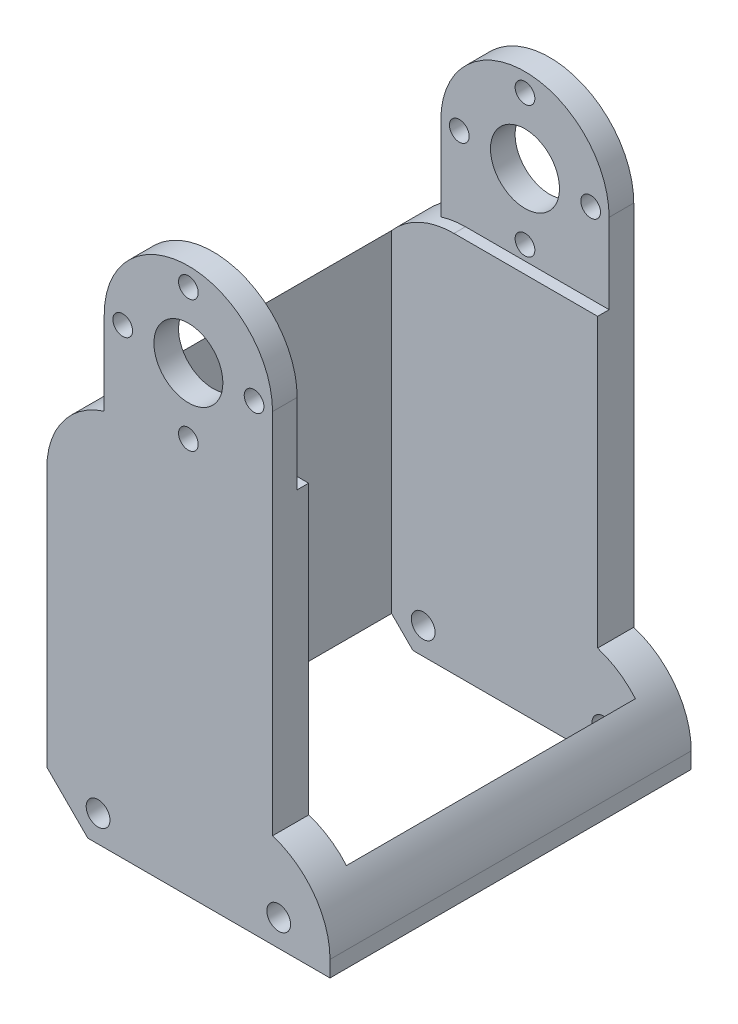
from build123d import *

# Parameters (mm, degrees)
BOSS_EXTRUDE1_DEPTH      = 22
BOSS_EXTRUDE1_DEPTH_BACK = 22
SKETCH2_W                = 38
SKETCH2_H                = 20
CUT_EXTRUDE1_DEPTH       = 105.423416914
SKETCH3_W                = 7
SKETCH3_H                = 44
BOSS_EXTRUDE2_DEPTH      = 65.5
SKETCH23_R               = 5
SKETCH23_R_2             = 1.2
CUT_EXTRUDE2_DEPTH       = 111.605436123
SKETCH24_W               = 28.5
SKETCH24_H               = 34
CUT_EXTRUDE3_DEPTH       = 90.954502389
SKETCH26_R               = 1.2
SKETCH26_R_2             = 5
SKETCH26_R_3             = 1.45
CUT_EXTRUDE6_DEPTH       = 107.330263801
SKETCH27_W               = 29.7
SKETCH27_H               = 35.2
CUT_EXTRUDE8_DEPTH       = 73.137455597
SKETCH29_W               = 7
SKETCH29_H               = 35
CUT_EXTRUDE10_DEPTH      = 74.468530678
CHAMFER2_SIZE            = 5
FILLET1_START            = -23
FILLET1_DEPTH            = 46
FILLET2_R                = 10


with BuildPart() as part:
    # Sketch1 → Boss-Extrude1 (new, two sides: drawn at the far end of the back side and taken through both)
    with BuildSketch(Plane.XY.offset(-BOSS_EXTRUDE1_DEPTH_BACK)):
        with BuildLine():
            Line((10.25, -60), (10.25, 0))
            ThreePointArc((10.25, 0), (0, -10.25), (-10.25, 0))
            Line((-10.25, 0), (-10.25, -60))
            Line((-10.25, -60), (-10.25, -100))
            Line((-10.25, -100), (10.25, -100))
            Line((10.25, -100), (10.25, -60))
        make_face()
        with BuildLine():
            Line((10.25, 0), (9.2, 0))
            ThreePointArc((9.2, 0), (8.816088231, -0.879772698), (7.91, -1.196620241))
            ThreePointArc((7.91, -1.196620241), (5.656854249, -5.656854249), (1.196620241, -7.91))
            ThreePointArc((1.196620241, -7.91), (1.199154762, -7.954968281), (1.2, -8))
            ThreePointArc((1.2, -8), (-0.045031719, -9.199154762), (-1.196620241, -7.91))
            ThreePointArc((-1.196620241, -7.91), (-5.656854249, -5.656854249), (-7.91, -1.196620241))
            ThreePointArc((-7.91, -1.196620241), (-8.816088231, -0.879772698), (-9.2, 0))
            Line((-9.2, 0), (-10.25, 0))
            ThreePointArc((-10.25, 0), (0, -10.25), (10.25, 0))
        make_face()
        with BuildLine():
            ThreePointArc((7.91, -1.196620241), (7.120227302, -0.816088231), (6.8, 0))
            Line((6.8, 0), (4.2, 0))
            ThreePointArc((4.2, 0), (0, -4.2), (-4.2, 0))
            Line((-4.2, 0), (-6.8, 0))
            ThreePointArc((-6.8, 0), (-7.120227302, -0.816088231), (-7.91, -1.196620241))
            ThreePointArc((-7.91, -1.196620241), (-5.656854249, -5.656854249), (-1.196620241, -7.91))
            ThreePointArc((-1.196620241, -7.91), (0, -6.8), (1.196620241, -7.91))
            ThreePointArc((1.196620241, -7.91), (5.656854249, -5.656854249), (7.91, -1.196620241))
        make_face()
        with BuildLine():
            Line((4.2, 0), (6.8, 0))
            ThreePointArc((6.8, 0), (7.120227302, 0.816088231), (7.91, 1.196620241))
            ThreePointArc((7.91, 1.196620241), (5.656854249, 5.656854249), (1.196620241, 7.91))
            ThreePointArc((1.196620241, 7.91), (0, 6.8), (-1.196620241, 7.91))
            ThreePointArc((-1.196620241, 7.91), (-5.656854249, 5.656854249), (-7.91, 1.196620241))
            ThreePointArc((-7.91, 1.196620241), (-7.120227302, 0.816088231), (-6.8, 0))
            Line((-6.8, 0), (-4.2, 0))
            ThreePointArc((-4.2, 0), (0, 4.2), (4.2, 0))
        make_face()
        with BuildLine():
            ThreePointArc((7.91, 1.196620241), (8.816088231, 0.879772698), (9.2, 0))
            Line((9.2, 0), (10.25, 0))
            ThreePointArc((10.25, 0), (0, 10.25), (-10.25, 0))
            Line((-10.25, 0), (-9.2, 0))
            ThreePointArc((-9.2, 0), (-8.816088231, 0.879772698), (-7.91, 1.196620241))
            ThreePointArc((-7.91, 1.196620241), (-5.656854249, 5.656854249), (-1.196620241, 7.91))
            ThreePointArc((-1.196620241, 7.91), (-0.045031719, 9.199154762), (1.2, 8))
            ThreePointArc((1.2, 8), (1.199154762, 7.954968281), (1.196620241, 7.91))
            ThreePointArc((1.196620241, 7.91), (5.656854249, 5.656854249), (7.91, 1.196620241))
        make_face()
    extrude(amount=BOSS_EXTRUDE1_DEPTH + BOSS_EXTRUDE1_DEPTH_BACK)

    # Sketch2 → Cut-Extrude1 (cut, through all)
    with BuildSketch(Plane.ZY.offset(10.25)):
        with Locations((0, 0.25)):
            Rectangle(SKETCH2_W, SKETCH2_H)
    extrude(amount=-CUT_EXTRUDE1_DEPTH, mode=Mode.SUBTRACT)

    # Sketch3 → Boss-Extrude2 (add)
    with BuildSketch(Plane(origin=(0, -9.75, 0), x_dir=(1, 0, 0), z_dir=(0, 1, 0))):
        with Locations((-13.75, 0)):
            Rectangle(SKETCH3_W, SKETCH3_H)
        with Locations((13.75, 0)):
            Rectangle(SKETCH3_W, SKETCH3_H)
    extrude(amount=-BOSS_EXTRUDE2_DEPTH)

    # Sketch23 → Cut-Extrude2 (cut, through all)
    with BuildSketch(Plane.XY.offset(22)):
        with BuildLine():
            Line((-10.25, -100), (10.25, -100))
            Line((10.25, -100), (10.25, -85))
            ThreePointArc((10.25, -85), (0, -95.25), (-10.25, -85))
            Line((-10.25, -85), (-10.25, -100))
        make_face()
        with Locations((0, -85)):
            Circle(SKETCH23_R)
        with Locations((8, -85)):
            Circle(SKETCH23_R_2)
        with Locations((0, -77)):
            Circle(SKETCH23_R_2)
        with Locations((0, -93)):
            Circle(SKETCH23_R_2)
        with Locations((-8, -85)):
            Circle(SKETCH23_R_2)
    extrude(amount=-CUT_EXTRUDE2_DEPTH, mode=Mode.SUBTRACT)

    # Sketch24 → Cut-Extrude3 (cut, through all)
    with BuildSketch(Plane(origin=(0, -9.75, 0), x_dir=(1, 0, 0), z_dir=(0, 1, 0))):
        Rectangle(SKETCH24_W, SKETCH24_H)
    extrude(amount=-CUT_EXTRUDE3_DEPTH, mode=Mode.SUBTRACT)

    # Sketch26 → Cut-Extrude6 (cut, through all)
    # profile 1 of 5: a face of its own
    with BuildSketch(Plane.XY.offset(22)):
        with BuildLine():
            Line((10.25, -75.25), (14.25, -75.25))
            Line((14.25, -75.25), (14.25, -56.53282359))
            Line((14.25, -56.53282359), (14.25, -56.25))
            Line((14.25, -56.25), (-14.25, -56.25))
            Line((-14.25, -56.25), (-14.25, -56.53282359))
            Line((-14.25, -56.53282359), (-14.25, -75.25))
            Line((-14.25, -75.25), (-10.25, -75.25))
            Line((-10.25, -75.25), (-10.25, -85))
            ThreePointArc((-10.25, -85), (0, -95.25), (10.25, -85))
            Line((10.25, -85), (10.25, -75.25))
        make_face()
        with Locations((-8, -85)):
            Circle(SKETCH26_R, mode=Mode.SUBTRACT)
        with Locations((0, -85)):
            Circle(SKETCH26_R_2, mode=Mode.SUBTRACT)
        with Locations((0, -77)):
            Circle(SKETCH26_R, mode=Mode.SUBTRACT)
        with Locations((0, -93)):
            Circle(SKETCH26_R, mode=Mode.SUBTRACT)
        with Locations((8, -85)):
            Circle(SKETCH26_R, mode=Mode.SUBTRACT)
    # profile 2 of 5: a face of its own
    with BuildSketch(Plane.XY.offset(22)):
        Polygon((-17.25, -75.25), (-14.25, -75.25), (-14.25, -56.53282359), (-14.25, -56.25), (-17.25, -56.25), align=None)
    # profile 3 of 5: a face of its own
    with BuildSketch(Plane.XY.offset(22)):
        Polygon((14.25, -56.53282359), (14.25, -75.25), (17.25, -75.25), (17.25, -56.25), (14.25, -56.25), align=None)
    # profile 4 of 5: a face of its own
    with BuildSketch(Plane.XY.offset(22)):
        with Locations((-11, -53)):
            Circle(SKETCH26_R_3)
    # profile 5 of 5: a face of its own
    with BuildSketch(Plane.XY.offset(22)):
        with Locations((11, -53)):
            Circle(SKETCH26_R_3)
    extrude(amount=-CUT_EXTRUDE6_DEPTH, mode=Mode.SUBTRACT)

    # Sketch27 → Cut-Extrude8 (cut, through all)
    with BuildSketch(Plane.XZ.offset(56.25)):
        Rectangle(SKETCH27_W, SKETCH27_H)
    extrude(amount=-CUT_EXTRUDE8_DEPTH, mode=Mode.SUBTRACT)

    # Sketch29 → Cut-Extrude10 (cut, through all)
    with BuildSketch(Plane(origin=(0, 0, -22), x_dir=(-1, 0, 0), z_dir=(0, 0, -1))):
        with Locations((-13.75, -27.25)):
            Rectangle(SKETCH29_W, SKETCH29_H)
    extrude(amount=-CUT_EXTRUDE10_DEPTH, mode=Mode.SUBTRACT)

    # Chamfer2
    # the kernel refuses this chamfer: 5 mm, written as the material it takes off along each edge
    with BuildSketch(Plane(origin=(-17.25, -56.25, 34.85841494), x_dir=(1, 0, 0), z_dir=(0, 0, -1))) as chamfer2_piece_1:
        Polygon((CHAMFER2_SIZE, 0), (0, -CHAMFER2_SIZE), (0, 0), align=None)
    extrude(amount=69.71682988, mode=Mode.SUBTRACT)

    # Fillet1: read off the stored shape, not the designer's step
    # Fillet1 outline → Fillet1 (cut)
    with BuildSketch(Plane.XY.offset(FILLET1_START)):
        with BuildLine():
            ThreePointArc((10.25, -44.75), (15.312257748, -48.373312231), (17.25, -54.289392014))
            Line((17.25, -54.289392014), (17.25, -44.75))
            Line((17.25, -44.75), (10.25, -44.75))
        make_face()
    extrude(amount=FILLET1_DEPTH, mode=Mode.SUBTRACT)

    # Fillet2
    # the kernel refuses this fillet: 10 mm, written as the material it takes off along each edge
    with BuildSketch(Plane(origin=(-17.25, -9.75, -47), x_dir=(1, 0, 0), z_dir=(0, 0, 1))) as fillet2_piece_1_section:
        with BuildLine():
            CenterArc((FILLET2_R, -FILLET2_R), FILLET2_R, 90, 90)
            Line((0, -FILLET2_R), (0, 0))
            Line((0, 0), (FILLET2_R, 0))
        make_face()
    fillet2_piece_1 = extrude(amount=94, mode=Mode.PRIVATE)
    fillet2_piece_1 = split(fillet2_piece_1, bisect_by=Plane(origin=(-10.25, -9.75, -47), z_dir=(-1, 0, 0)), keep=Keep.TOP, mode=Mode.PRIVATE)
    add(fillet2_piece_1, mode=Mode.SUBTRACT)
    with BuildSketch(Plane(origin=(-17.25, -9.75, -47), x_dir=(1, 0, 0), z_dir=(0, 0, 1))) as fillet2_piece_2_section:
        with BuildLine():
            CenterArc((FILLET2_R, -FILLET2_R), FILLET2_R, 90, 90)
            Line((0, -FILLET2_R), (0, 0))
            Line((0, 0), (FILLET2_R, 0))
        make_face()
    fillet2_piece_2 = extrude(amount=94, mode=Mode.PRIVATE)
    fillet2_piece_2 = split(fillet2_piece_2, bisect_by=Plane(origin=(-17.25, -9.75, -19), z_dir=(0, 0, 1)), keep=Keep.TOP, mode=Mode.PRIVATE)
    fillet2_piece_2 = split(fillet2_piece_2, bisect_by=Plane(origin=(-17.25, -9.75, 19), z_dir=(0, 0, -1)), keep=Keep.TOP, mode=Mode.PRIVATE)
    add(fillet2_piece_2, mode=Mode.SUBTRACT)


solid = part.part
